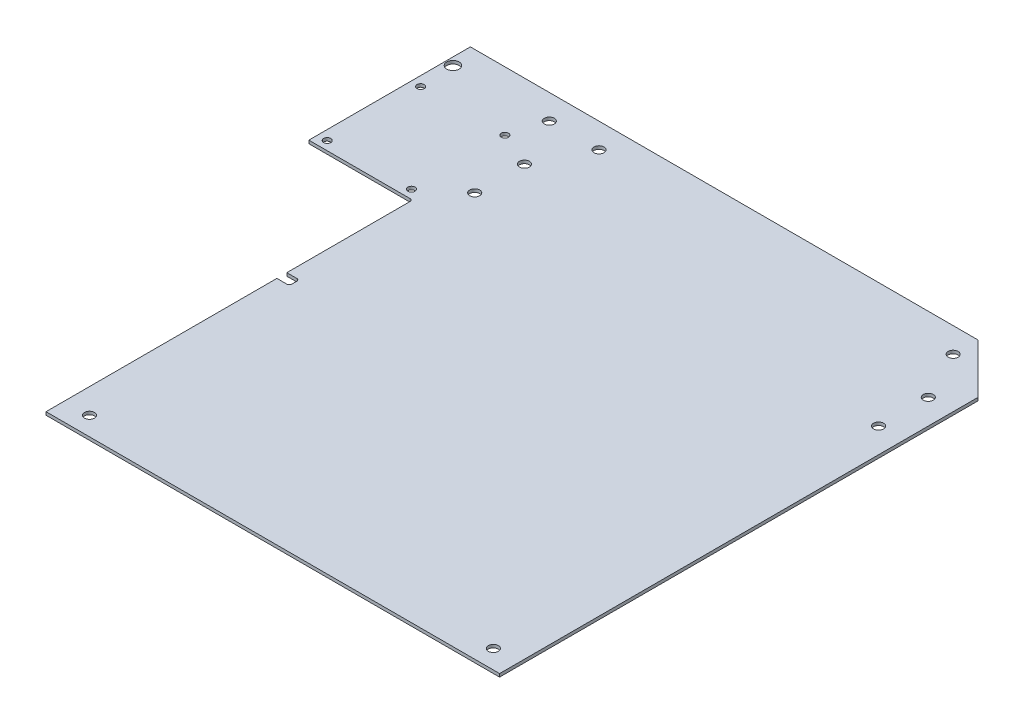
from build123d import *

# Parameters (mm, degrees)
BOSS_EXTRUDE1_DEPTH         = 1.5875
F_10_CLEARANCE_HOLE1_D      = 5.1054
F_1_4_0_25_DIAMETER_HOLE1_D = 6.35
F_6_CLEARANCE_HOLE1_D       = 3.6576
CUT_EXTRUDE1_DEPTH          = 306.201250058


with BuildPart() as part:
    # Sketch3 → Boss-Extrude1 (new body)
    with BuildSketch(Plane(origin=(0, 0, 0), x_dir=(1, 0, 0), z_dir=(0, 1, 0))):
        with BuildLine():
            Line((-96.156504661, -3.621535329), (-96.156504661, 182.433464668))
            ThreePointArc((-96.156504661, 182.433464668), (-96.528479048, 183.33149028), (-97.426504661, 183.703464668))
            Line((-97.426504661, 183.703464668), (-149.179004665, 183.703464668))
            Line((-149.179004665, 183.703464668), (-149.179004665, 266.253464668))
            Line((-149.179004665, 266.253464668), (-70.756504695, 266.253464668))
            Line((-70.756504695, 266.253464668), (110.218495881, 266.253464668))
            Line((110.218495881, 266.253464668), (135.618495767, 240.853464671))
            Line((135.618495767, 240.853464671), (135.618495767, -3.621535329))
            Line((135.618495767, -3.621535329), (-96.156504661, -3.621535329))
        make_face()
    extrude(amount=BOSS_EXTRUDE1_DEPTH)

    # #10 Clearance Hole1 (through all)
    with Locations(Plane(origin=(0, 1.5875, 0), x_dir=(1, 0, 0), z_dir=(0, 1, 0))):
        with Locations((-83.456504705, -25.846534826), (-83.456504732, 202.753465682), (-83.456504732, 228.153465682), (-70.756504732, 253.553465682), (122.918495769, 202.753464669), (122.918495769, 228.153464669), (110.218495769, 253.553464669), (-83.456504708, 5.903465174), (122.918495795, 5.903465177), (-96.156504732, 253.553465682)):
            Hole(F_10_CLEARANCE_HOLE1_D / 2)

    # 1/4 (0.25) Diameter Hole1 (through all)
    with Locations(Plane(origin=(0, 0, 0), x_dir=(-1, 0, 0), z_dir=(0, -1, 0))):
        with Locations((145.369004665, 253.553464668)):
            Hole(F_1_4_0_25_DIAMETER_HOLE1_D / 2)

    # #6 Clearance Hole1 (through all)
    with Locations(Plane(origin=(0, 1.5875, 0), x_dir=(1, 0, 0), z_dir=(0, 1, 0))):
        with Locations((-144.305157527, 235.976041671), (-144.305157527, 188.226395138), (-101.258714708, 188.226395138), (-101.258714708, 235.978395138)):
            Hole(F_6_CLEARANCE_HOLE1_D / 2)

    # Sketch17 → Cut-Extrude1 (cut, through all)
    with BuildSketch(Plane(origin=(0, 1.5875, 0), x_dir=(1, 0, 0), z_dir=(0, 1, 0))):
        with BuildLine():
            Line((-96.156504661, 114.361464671), (-91.076504661, 114.361464671))
            ThreePointArc((-91.076504661, 114.361464671), (-90.178479048, 114.733439059), (-89.806504661, 115.631464671))
            Line((-89.806504661, 115.631464671), (-89.806504661, 118.171464671))
            ThreePointArc((-89.806504661, 118.171464671), (-90.178479048, 119.069490283), (-91.076504661, 119.441464671))
            Line((-91.076504661, 119.441464671), (-96.156504661, 119.441464671))
            Line((-96.156504661, 119.441464671), (-96.156504661, 114.361464671))
        make_face()
    extrude(amount=-CUT_EXTRUDE1_DEPTH, mode=Mode.SUBTRACT)


solid = part.part
